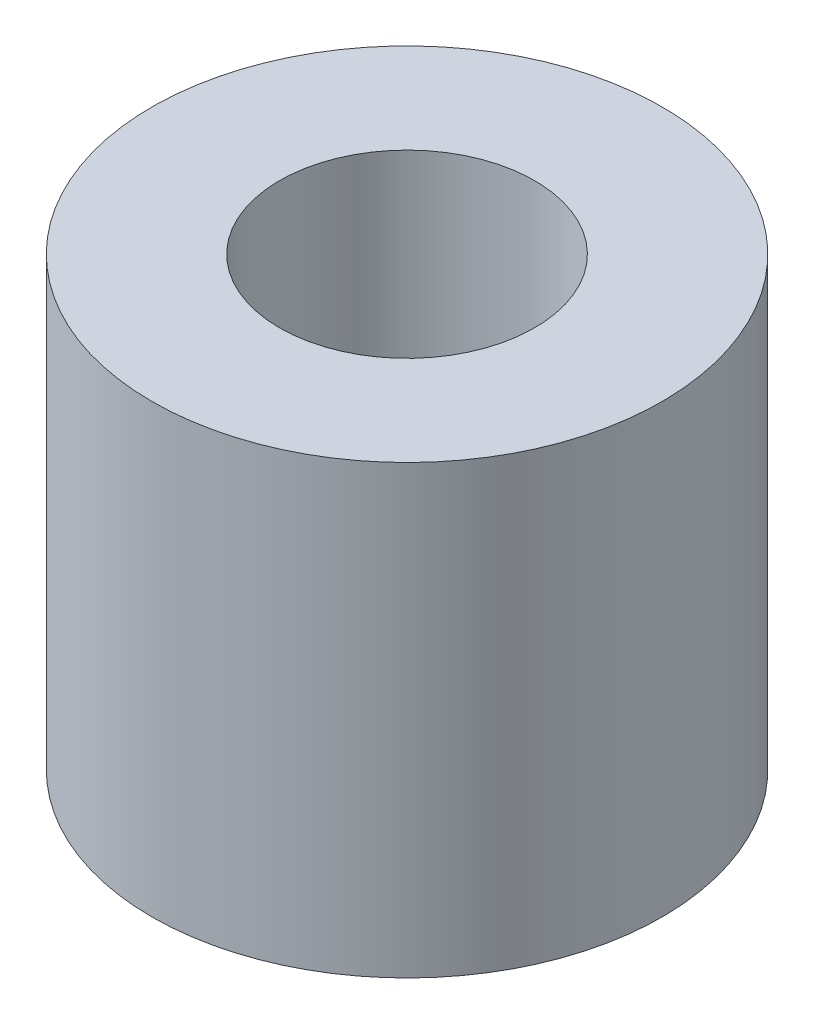
from build123d import *

# Parameters (mm, degrees)
SKETCH1_R           = 6.35
SKETCH1_R_2         = 3.175
BOSS_EXTRUDE1_DEPTH = 5.55625


with BuildPart() as part:
    # Sketch1 → Boss-Extrude1 (new, symmetric)
    with BuildSketch(Plane(origin=(0, 0, 0), x_dir=(1, 0, 0), z_dir=(0, 1, 0))):
        Circle(SKETCH1_R)
        Circle(SKETCH1_R_2, mode=Mode.SUBTRACT)
    extrude(amount=BOSS_EXTRUDE1_DEPTH, both=True)


solid = part.part
